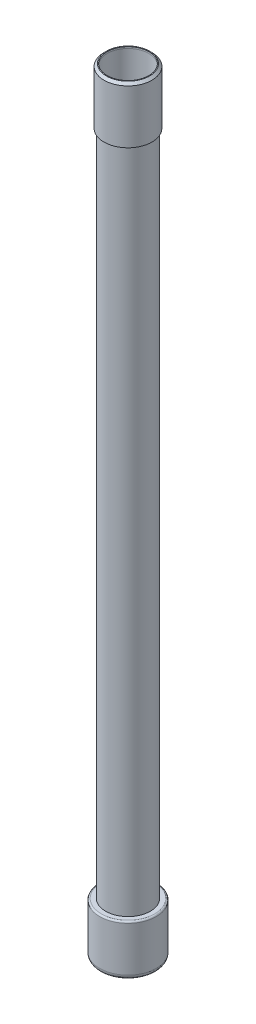
from build123d import *

# Parameters (mm, degrees)
SKETCH1_R      = 14
SKETCH1_R_2    = 13
EXTRUDE1_DEPTH = 240
FILLET1_R      = 3
FILLET2_R      = 1
CHAMFER1_SIZE  = 1.5


with BuildPart() as part:
    # Sketch1 → Extrude1 (new, symmetric)
    with BuildSketch(Plane(origin=(0, 0, 0), x_dir=(1, 0, 0), z_dir=(0, 1, 0))):
        Circle(SKETCH1_R)
        Circle(SKETCH1_R_2, mode=Mode.SUBTRACT)
    extrude(amount=EXTRUDE1_DEPTH, both=True)


with BuildPart() as body_2:
    # Sketch2 → Revolve1 (revolve)
    with BuildSketch(Plane.XY):
        with BuildLine():
            Line((13, -211), (17.75, -211))
            Line((17.75, -211), (17.75, -242))
            ThreePointArc((17.75, -242), (9.097561486, -244.987616596), (0, -246))
            Line((0, -246), (0, -240))
            Line((0, -240), (13, -240))
            Line((13, -240), (13, -211))
        make_face()
    revolve(axis=Axis((0, -191.854456481, 0), (0, -1, 0)))

    # Fillet1
    fillet1_edges = [body_2.edges().sort_by_distance(p)[0] for p in [
        (-17.75, -242, 0),
    ]]
    fillet(fillet1_edges, radius=FILLET1_R)

    # Fillet2
    fillet2_edges = [body_2.edges().sort_by_distance(p)[0] for p in [
        (-17.75, -211, 0),
    ]]
    fillet(fillet2_edges, radius=FILLET2_R)


with BuildPart() as body_3:
    # Sketch3 → Revolve2 (revolve)
    with BuildSketch(Plane.XY):
        Polygon((15, 241), (15, 206), (14, 206), (14, 240), (13, 240), (13, 241), align=None)
    revolve(axis=Axis((0, 250.648791431, 0), (0, -1, 0)))

    # Chamfer1
    chamfer1_edges = [body_3.edges().sort_by_distance(p)[0] for p in [
        (-15, 241, 0),
    ]]
    chamfer(chamfer1_edges, length=CHAMFER1_SIZE)


solid = Compound([part.part, body_2.part, body_3.part])
